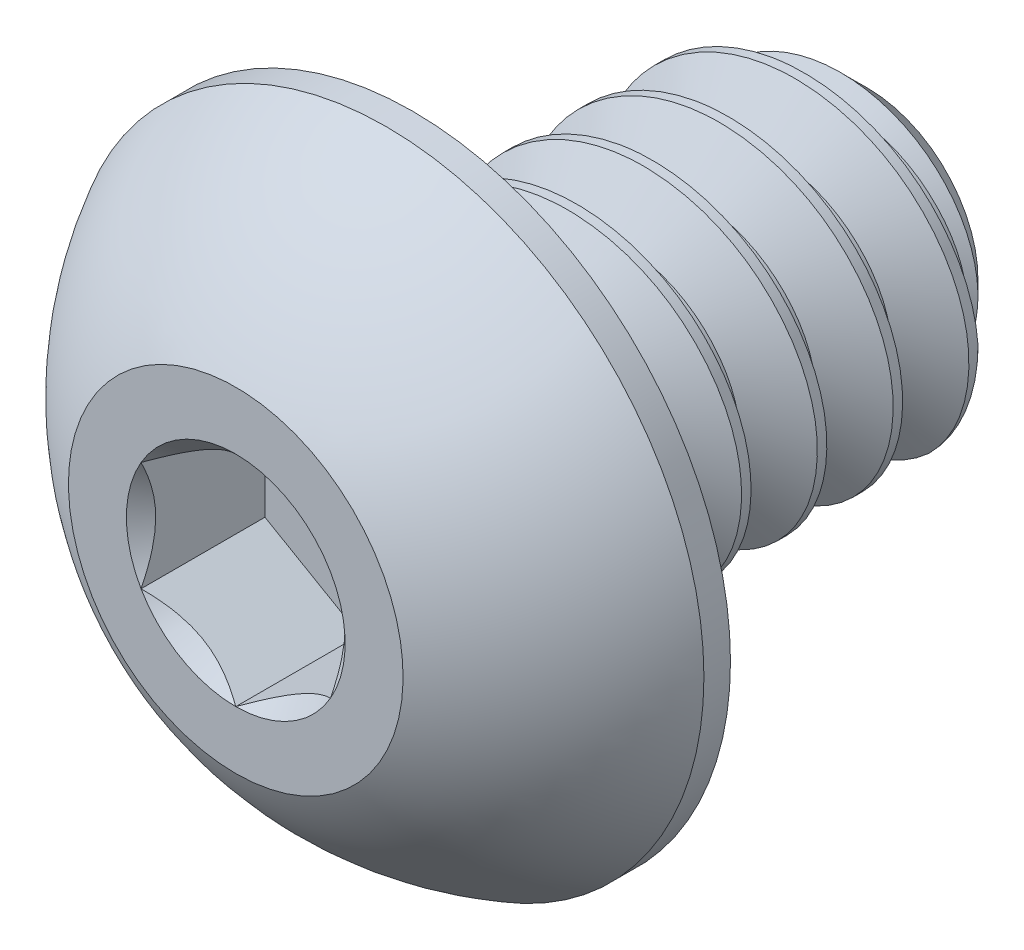
from build123d import *

# Parameters (mm, degrees)
SKETCH1_W          = 4.7625
SKETCH1_H          = 1.7526
CHAMFER1_SIZE      = 0.5953125
CUT_SWEEP1_PITCH   = 0.79375
CUT_EXTRUDE2_DEPTH = 1.29794


with BuildPart() as part:
    # Sketch1 → Revolve1 (revolve)
    with BuildSketch(Plane(origin=(0, 0, 0), x_dir=(0, 0, -1), z_dir=(1, 0, 0))):
        with Locations((4.23545, 0.8763)):
            Rectangle(SKETCH1_W, SKETCH1_H)
    revolve(axis=Axis((0, 0, -6.6167), (0, 0, 1)))

    # Chamfer1
    chamfer1_edges = [part.edges().sort_by_distance(p)[0] for p in [
        (0, -1.7526, -6.6167),
    ]]
    chamfer(chamfer1_edges, length=CHAMFER1_SIZE)

    # Cut-Sweep1: the profile of Sketch2 profile screwed along a right-hand helix of 8.336 turns, 8 arcs to a turn; built about Z, then put on its axis
    cut_sweep1_z = Axis((0, 0, 0), (0, 0, 1))
    cut_sweep1_corners = [(1.7529, 0, 0.000173205), (1.7529, 0, -0.694704455), (1.237044252, 0, -0.396875), (1.237044252, 0, -0.29765625)]
    with BuildLine(mode=Mode.PRIVATE) as cut_sweep1_profile:
        Line(cut_sweep1_corners[0], cut_sweep1_corners[1])
        Line(cut_sweep1_corners[1], cut_sweep1_corners[2])
        Line(cut_sweep1_corners[2], cut_sweep1_corners[3])
        Line(cut_sweep1_corners[3], cut_sweep1_corners[0])
    cut_sweep1_cap = Face(cut_sweep1_profile.wire())
    cut_sweep1_turn_angles = [0, 22.5, 45, 67.5, 90, 112.5, 135, 157.5, 180, 202.5, 225, 247.5, 270, 292.5, 315, 337.5, 360]
    cut_sweep1_turn_weights = [1, 0.9238795325112867, 1, 0.9238795325112867, 1, 0.9238795325112867, 1, 0.9238795325112867, 1, 0.9238795325112867, 1, 0.9238795325112867, 1, 0.9238795325112867, 1, 0.9238795325112867, 1]
    cut_sweep1_turn_rails = [Edge.make_bspline([Vector(p[0], p[1], 0).rotate(cut_sweep1_z, cut_sweep1_turn_angles[k]) / cut_sweep1_turn_weights[k] + Vector(0, 0, p[2] + CUT_SWEEP1_PITCH * cut_sweep1_turn_angles[k] / 360) for k in range(17)], [0, 0, 0, 1, 1, 2, 2, 3, 3, 4, 4, 5, 5, 6, 6, 7, 7, 8, 8, 8], 2, cut_sweep1_turn_weights) for p in cut_sweep1_corners]
    cut_sweep1_turn_sides = [Face.make_surface_from_curves(cut_sweep1_turn_rails[p[0]], cut_sweep1_turn_rails[p[1]]) for p in [(0, 1), (1, 2), (2, 3), (3, 0)]]
    cut_sweep1_last_angles = [2880, 2902.5, 2925, 2947.5, 2970, 2985.48, 3000.96]
    cut_sweep1_last_weights = [1, 0.9238795325112867, 1, 0.9238795325112867, 1, 0.9637236782899715, 1]
    cut_sweep1_last_rails = [Edge.make_bspline([Vector(p[0], p[1], 0).rotate(cut_sweep1_z, cut_sweep1_last_angles[k]) / cut_sweep1_last_weights[k] + Vector(0, 0, p[2] + CUT_SWEEP1_PITCH * cut_sweep1_last_angles[k] / 360) for k in range(7)], [0, 0, 0, 1, 1, 2, 2, 3, 3, 3], 2, cut_sweep1_last_weights) for p in cut_sweep1_corners]
    cut_sweep1_last_sides = [Face.make_surface_from_curves(cut_sweep1_last_rails[p[0]], cut_sweep1_last_rails[p[1]]) for p in [(0, 1), (1, 2), (2, 3), (3, 0)]]
    cut_sweep1 = Plane(origin=(0, 0, -6.6167), x_dir=(0, 1, 0), z_dir=(0, 0, 1)) * Solid(Shell([*[p.moved(Location((0, 0, CUT_SWEEP1_PITCH * i))) for i in range(8) for p in cut_sweep1_turn_sides], *cut_sweep1_last_sides, cut_sweep1_cap, cut_sweep1_cap.rotate(cut_sweep1_z, 3000.96).moved(Location((0, 0, CUT_SWEEP1_PITCH * 3000.96 / 360)))]))
    add(cut_sweep1, mode=Mode.SUBTRACT)

    # Sketch7 → Revolve2 (revolve)
    with BuildSketch(Plane(origin=(0, 0, 0), x_dir=(0, 0, -1), z_dir=(1, 0, 0)), mode=Mode.PRIVATE) as revolve2_sk:
        with BuildLine():
            Line((1.57607, 3.3274), (1.8542, 3.3274))
            Line((1.8542, 3.3274), (1.8542, 0))
            Line((1.8542, 0), (0, 0))
            Line((0, 0), (0, 1.7526))
            ThreePointArc((0, 1.7526), (0.668695369, 2.659435873), (1.57607, 3.3274))
        make_face()
    revolve(revolve2_sk.sketch.rotate(Axis((0, 0, 0), (0, 0, -1)), 189.052465709), axis=Axis((0, 0, 0), (0, 0, -1)))

    # Sketch5 → Cut-Extrude2 (cut)
    with BuildSketch(Plane.XY):
        Polygon((0.9921875, -0.57283972), (0.9921875, 0.57283972), (0, 1.14567944), (-0.9921875, 0.57283972), (-0.9921875, -0.57283972), (0, -1.14567944), align=None)
    extrude(amount=-CUT_EXTRUDE2_DEPTH, mode=Mode.SUBTRACT)

    # Cut-Extrude3 cone 1 section (through the dimple's axis) → Cut-Extrude3 (revolve, cut)
    with BuildSketch(Plane(origin=(0, 0, 0), x_dir=(0, -1, 0), z_dir=(1, 0, 0))):
        Polygon((0, 0), (1.14567944, 0), (0, 1.14567944), align=None)
    revolve(axis=Axis((0, 0, 0), (0, 0, -1)), mode=Mode.SUBTRACT)


solid = part.part
